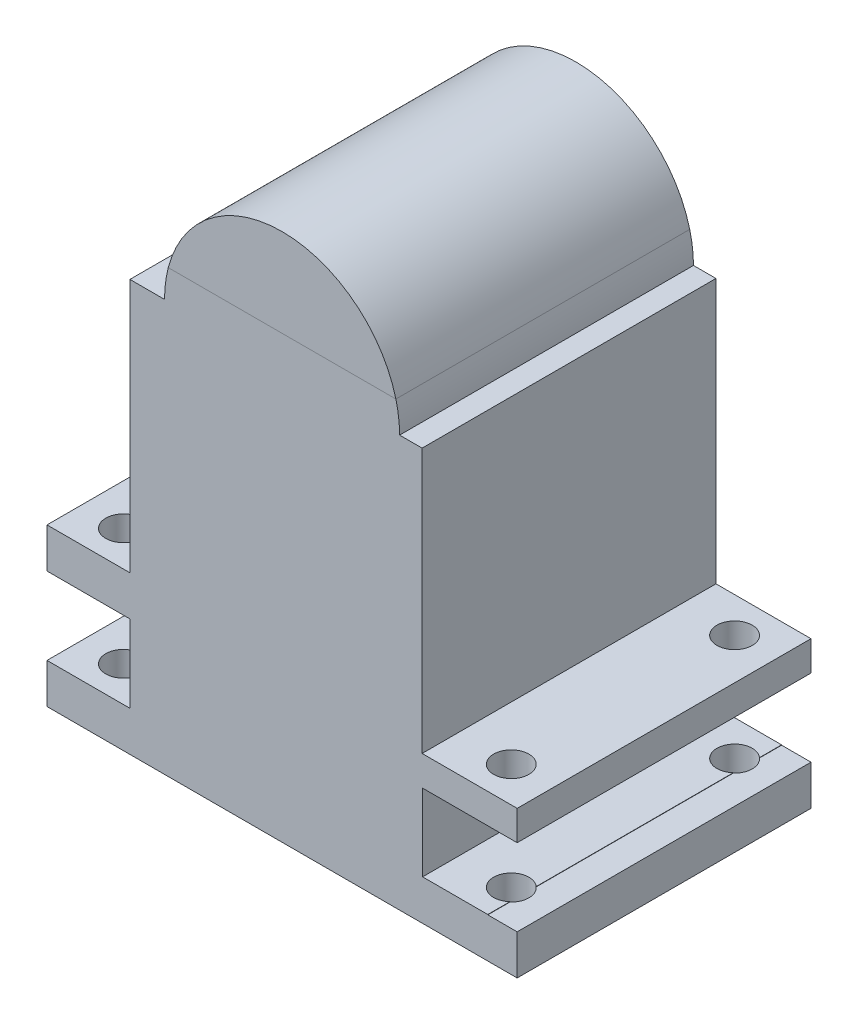
from build123d import *

# Parameters (mm, degrees)
BOSS_EXTRU_1_DEPTH      = 500
ESQUISSE2_W             = 700
ESQUISSE2_H             = 500
BOSS_EXTRU_2_DEPTH      = 250
ESQUISSE4_W             = 91.072749712
ESQUISSE4_H             = 131.669737078
ENL_V_MAT_EXTRU_2_DEPTH = 500
ESQUISSE5_W             = 110.887682399
ESQUISSE5_H             = 130.745719327
ENL_V_MAT_EXTRU_3_DEPTH = 500
ESQUISSE9_W             = 50
ESQUISSE9_H             = 500.658692186
ESQUISSE9_H_2           = 68.053564491
ESQUISSE9_H_3           = 500.318853577
ESQUISSE9_H_4           = 68.011409345
BOSS_EXTRU_3_DEPTH      = 500
ESQUISSE10_W            = 141.072749712
ESQUISSE10_H            = 432.308853577
ESQUISSE10_W_2          = 161.717775925
ESQUISSE10_H_2          = 450
ENL_V_MAT_EXTRU_6_DEPTH = 500
ESQUISSE11_R            = 30
ENL_V_MAT_EXTRU_7_DEPTH = 310
ESQUISSE12_R            = 30
ENL_V_MAT_EXTRU_8_DEPTH = 310


with BuildPart() as part:
    # Esquisse1 → Boss.-Extru.1 (new body)
    with BuildSketch(Plane.XY):
        with BuildLine():
            Line((0, 0), (700, 0))
            Line((700, 0), (700, 450))
            Line((700, 450), (550, 450))
            ThreePointArc((550, 450), (350, 650), (150, 450))
            Line((150, 450), (0, 450))
            Line((0, 450), (0, 0))
        make_face()
    extrude(amount=BOSS_EXTRU_1_DEPTH)

    # Esquisse2 → Boss.-Extru.2 (add)
    with BuildSketch(Plane.XZ):
        with Locations((350, 250)):
            Rectangle(ESQUISSE2_W, ESQUISSE2_H)
    extrude(amount=BOSS_EXTRU_2_DEPTH)

    # Esquisse4 → Enlèv. mat.-Extru.2 (cut)
    with BuildSketch(Plane(origin=(0, 0, 0), x_dir=(-1, 0, 0), z_dir=(0, 0, -1))):
        with Locations((-45.536374856, -116.153722116)):
            Rectangle(ESQUISSE4_W, ESQUISSE4_H)
    extrude(amount=-ENL_V_MAT_EXTRU_2_DEPTH, mode=Mode.SUBTRACT)

    # Esquisse5 → Enlèv. mat.-Extru.3 (cut)
    with BuildSketch(Plane(origin=(0, 0, 0), x_dir=(-1, 0, 0), z_dir=(0, 0, -1))):
        with Locations((-644.556158801, -116.03155185)):
            Rectangle(ESQUISSE5_W, ESQUISSE5_H)
    extrude(amount=-ENL_V_MAT_EXTRU_3_DEPTH, mode=Mode.SUBTRACT)


with BuildPart() as body_2:
    # Fractionner2: the piece on the far side of the plane
    add(part.part)
    split(bisect_by=Plane(origin=(0, 500, 0), x_dir=(0, 0, -1), z_dir=(0, -1, 0)), keep=Keep.BOTTOM)


with BuildPart() as part_1:
    add(part.part)

    # Fractionner2
    split(bisect_by=Plane(origin=(0, 500, 0), x_dir=(0, 0, -1), z_dir=(0, -1, 0)), keep=Keep.TOP)

    # Esquisse9 → Boss.-Extru.3 (add)
    with BuildSketch(Plane.XY.offset(500)):
        with Locations((725, 199.670653907)):
            Rectangle(ESQUISSE9_W, ESQUISSE9_H)
        with Locations((725, -215.973217755)):
            Rectangle(ESQUISSE9_W, ESQUISSE9_H_2)
        with Locations((-25, 199.840573211)):
            Rectangle(ESQUISSE9_W, ESQUISSE9_H_3)
        with Locations((-25, -215.994295328)):
            Rectangle(ESQUISSE9_W, ESQUISSE9_H_4)
    extrude(amount=-BOSS_EXTRU_3_DEPTH)

    # Esquisse10 → Enlèv. mat.-Extru.6 (cut)
    with BuildSketch(Plane.XY.offset(500)):
        with Locations((20.536374856, 233.845573212)):
            Rectangle(ESQUISSE10_W, ESQUISSE10_H)
        with Locations((669.141112038, 225)):
            Rectangle(ESQUISSE10_W_2, ESQUISSE10_H_2)
    extrude(amount=-ENL_V_MAT_EXTRU_6_DEPTH, mode=Mode.SUBTRACT)

    # Esquisse11 → Enlèv. mat.-Extru.7 (cut)
    with BuildSketch(Plane(origin=(0, 17.691146423, 0), x_dir=(1, 0, 0), z_dir=(0, 1, 0))):
        with Locations((20, -60)):
            Circle(ESQUISSE11_R)
        with Locations((20, -440)):
            Circle(ESQUISSE11_R)
    extrude(amount=-ENL_V_MAT_EXTRU_7_DEPTH, mode=Mode.SUBTRACT)

    # Esquisse12 → Enlèv. mat.-Extru.8 (cut)
    with BuildSketch(Plane(origin=(0, 0, 0), x_dir=(1, 0, 0), z_dir=(0, 1, 0))):
        with Locations((680, -60)):
            Circle(ESQUISSE12_R)
        with Locations((680, -440)):
            Circle(ESQUISSE12_R)
    extrude(amount=-ENL_V_MAT_EXTRU_8_DEPTH, mode=Mode.SUBTRACT)


solid = Compound([body_2.part, part_1.part])
